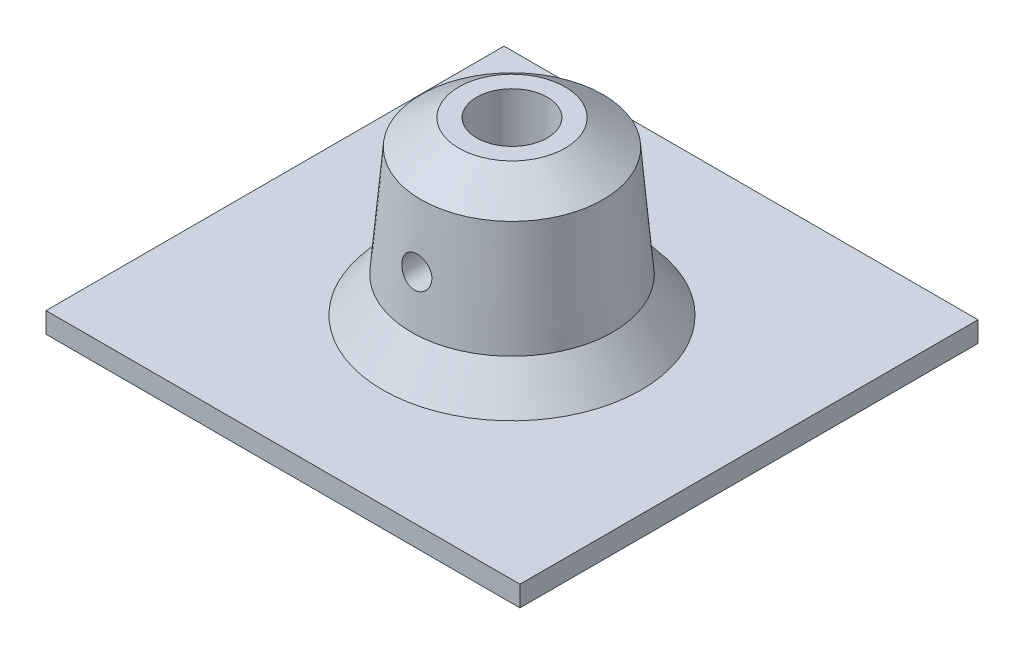
from build123d import *

# Parameters (mm, degrees)
SKETCH1_W           = 27.7
SKETCH1_H           = 26.77
BOSS_EXTRUDE1_DEPTH = 1.2
SKETCH2_R           = 6.065
BOSS_EXTRUDE2_DEPTH = 10
BOSS_EXTRUDE2_TAPER = 5
SKETCH3_R           = 2.065
CUT_EXTRUDE1_DEPTH  = 9
CHAMFER1_SIZE       = 1.5
CHAMFER1_SIZE_2     = 2.084645451
SKETCH4_R           = 0.875
CUT_EXTRUDE2_DEPTH  = 9


with BuildPart() as part:
    # Sketch1 → Boss-Extrude1 (new body)
    with BuildSketch(Plane(origin=(0, 0, 0), x_dir=(1, 0, 0), z_dir=(0, 1, 0))):
        Rectangle(SKETCH1_W, SKETCH1_H)
    extrude(amount=BOSS_EXTRUDE1_DEPTH)

    # Sketch2 → Boss-Extrude2 (add)
    with BuildSketch(Plane(origin=(0, 1.2, 0), x_dir=(1, 0, 0), z_dir=(0, 1, 0))):
        Circle(SKETCH2_R)
    extrude(amount=BOSS_EXTRUDE2_DEPTH, taper=BOSS_EXTRUDE2_TAPER)

    # Sketch3 → Cut-Extrude1 (cut)
    with BuildSketch(Plane(origin=(0, 11.2, 0), x_dir=(1, 0, 0), z_dir=(0, 1, 0))):
        with Locations(Location((0, 0, 0), (0, 0, 270))):
            Circle(SKETCH3_R)
    extrude(amount=-CUT_EXTRUDE1_DEPTH, mode=Mode.SUBTRACT)

    # Chamfer1
    # the kernel refuses this chamfer: 2.084645451, 1.5 mm, written as the material it adds along each edge
    with BuildSketch(Plane(origin=(0, 1.2, 0), x_dir=(1, 0, 0), z_dir=(0, 0, 1))) as chamfer1_piece_1:
        Polygon((6.065 + CHAMFER1_SIZE, 0), (6.065 - CHAMFER1_SIZE_2 * 0.0871557427277, CHAMFER1_SIZE_2 * 0.996194697864), (6.065, 0), align=None)
    revolve(axis=Axis((0, 1.2, 0), (0, 1, 0)))
    # the kernel refuses this chamfer: 2.084645451, 1.5 mm, written as the material it takes off along each edge
    with BuildSketch(Plane(origin=(0, 11.2, 0), x_dir=(1, 0, 0), z_dir=(0, 0, -1))) as chamfer1_2_piece_1:
        Polygon((5.190113365 + CHAMFER1_SIZE * 0.0871557427477, CHAMFER1_SIZE * 0.996194698092), (5.190113365 - CHAMFER1_SIZE_2, 0), (5.190113365, 0), align=None)
    revolve(axis=Axis((0, 11.2, 0), (0, -1, 0)), mode=Mode.SUBTRACT)

    # Sketch4 → Cut-Extrude2 (cut)
    with BuildSketch(Plane.XY):
        with Locations(Location((0, 6.2, 0), (0, 0, 90.000000002))):
            Circle(SKETCH4_R)
    extrude(amount=CUT_EXTRUDE2_DEPTH, mode=Mode.SUBTRACT)


solid = part.part
